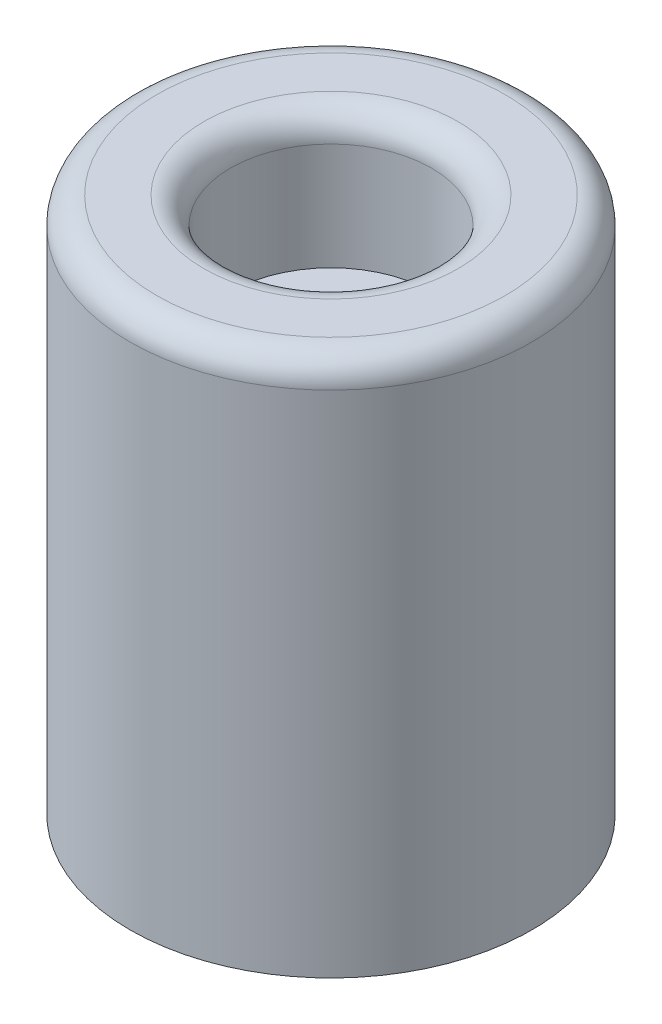
from build123d import *

# Parameters (mm, degrees)
SKETCH1_R           = 9.525
BOSS_EXTRUDE1_DEPTH = 25.4
SKETCH2_R           = 4.7625
CUT_EXTRUDE1_DEPTH  = 6.35
SKETCH3_R           = 1.984375
CUT_EXTRUDE2_DEPTH  = 24.3313898
FILLET1_R           = 1.27


with BuildPart() as part:
    # Sketch1 → Boss-Extrude1 (new body)
    with BuildSketch(Plane(origin=(0, 0, 0), x_dir=(1, 0, 0), z_dir=(0, 1, 0))):
        Circle(SKETCH1_R)
    extrude(amount=BOSS_EXTRUDE1_DEPTH)

    # Sketch2 → Cut-Extrude1 (cut)
    with BuildSketch(Plane(origin=(0, 25.4, 0), x_dir=(1, 0, 0), z_dir=(0, 1, 0))):
        Circle(SKETCH2_R)
    extrude(amount=-CUT_EXTRUDE1_DEPTH, mode=Mode.SUBTRACT)

    # Sketch3 → Cut-Extrude2 (cut, through all)
    with BuildSketch(Plane(origin=(0, 19.05, 0), x_dir=(1, 0, 0), z_dir=(0, 1, 0))):
        Circle(SKETCH3_R)
    extrude(amount=-CUT_EXTRUDE2_DEPTH, mode=Mode.SUBTRACT)

    # Fillet1
    fillet1_edges = [part.edges().sort_by_distance(p)[0] for p in [
        (-4.7625, 25.4, 0),
        (-9.525, 25.4, 0),
    ]]
    fillet(fillet1_edges, radius=FILLET1_R)


solid = part.part
